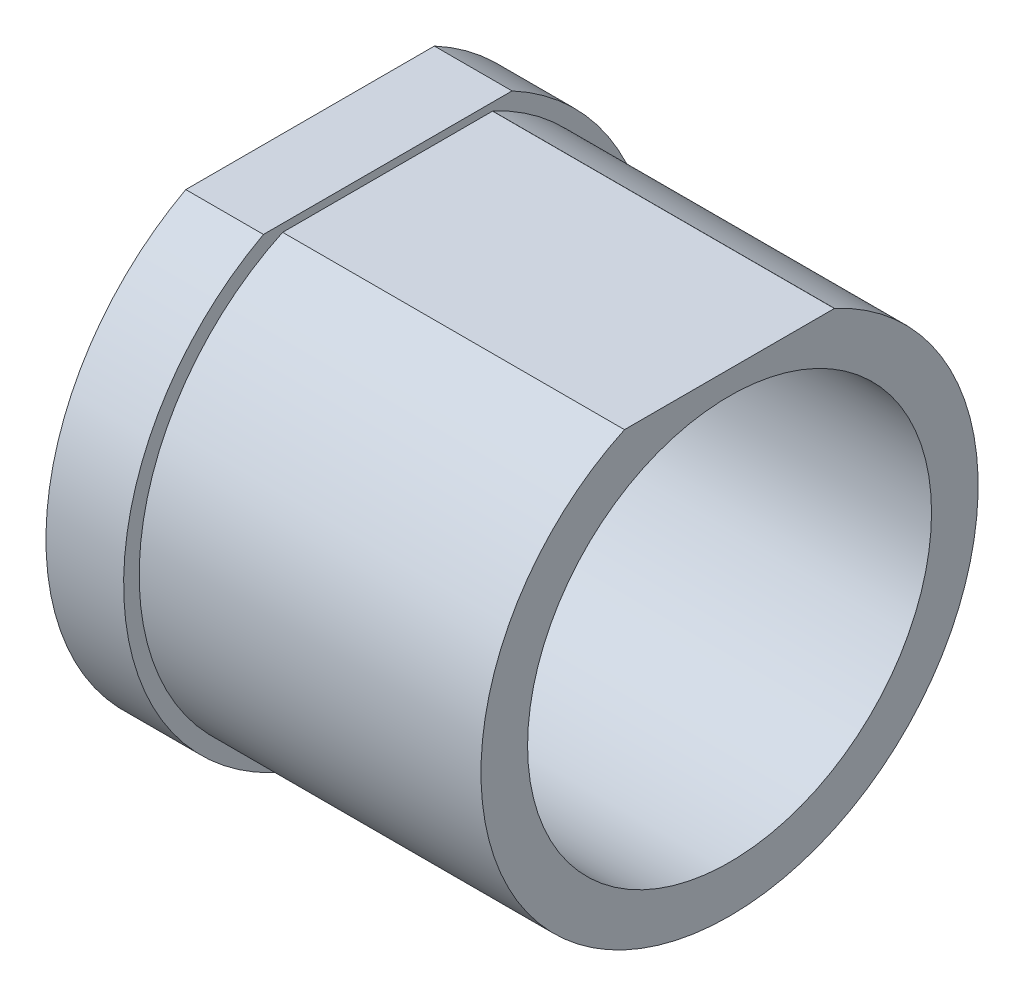
from build123d import *

# Parameters (mm, degrees)
SKETCH1_R           = 34
BOSS_EXTRUDE1_DEPTH = 10
SKETCH2_R           = 32
BOSS_EXTRUDE2_DEPTH = 44
SKETCH3_R           = 26
CUT_EXTRUDE1_DEPTH  = 73.30490993
SKETCH4_W           = 27.053672336
SKETCH4_H           = 7.688048191
CUT_EXTRUDE2_DEPTH  = 44
CUT_EXTRUDE3_REACH  = 74.305
SKETCH5_W           = 49.442103022
SKETCH5_H           = 7.290390526


with BuildPart() as part:
    # Sketch1 → Boss-Extrude1 (new body)
    with BuildSketch(Plane(origin=(0, 0, 0), x_dir=(0, 0, -1), z_dir=(1, 0, 0))):
        Circle(SKETCH1_R)
    extrude(amount=BOSS_EXTRUDE1_DEPTH)

    # Sketch2 → Boss-Extrude2 (add)
    with BuildSketch(Plane(origin=(10, 0, 0), x_dir=(0, 0, -1), z_dir=(1, 0, 0))):
        Circle(SKETCH2_R)
    extrude(amount=BOSS_EXTRUDE2_DEPTH)

    # Sketch3 → Cut-Extrude1 (cut, through all)
    with BuildSketch(Plane(origin=(54, 0, 0), x_dir=(0, 0, -1), z_dir=(1, 0, 0))):
        Circle(SKETCH3_R)
    extrude(amount=-CUT_EXTRUDE1_DEPTH, mode=Mode.SUBTRACT)

    # Sketch4 → Cut-Extrude2 (cut)
    with BuildSketch(Plane(origin=(54, 0, 0), x_dir=(0, 0, -1), z_dir=(1, 0, 0))):
        with Locations((-0.035028199, 32.844024096)):
            Rectangle(SKETCH4_W, SKETCH4_H)
    extrude(amount=-CUT_EXTRUDE2_DEPTH, mode=Mode.SUBTRACT)

    # Sketch5 → Cut-Extrude3 (cut, up to next)
    with BuildSketch(Plane.ZY, mode=Mode.PRIVATE) as cut_extrude3_sk1:
        with Locations((1.06042044, 33.645195263)):
            Rectangle(SKETCH5_W, SKETCH5_H)
    cut_extrude3_tool1 = extrude(cut_extrude3_sk1.sketch, amount=-CUT_EXTRUDE3_REACH, mode=Mode.PRIVATE) & part.part
    add(cut_extrude3_tool1.solids().sort_by_distance((0, 33.645195, 1.06042))[0], mode=Mode.SUBTRACT)


solid = part.part
